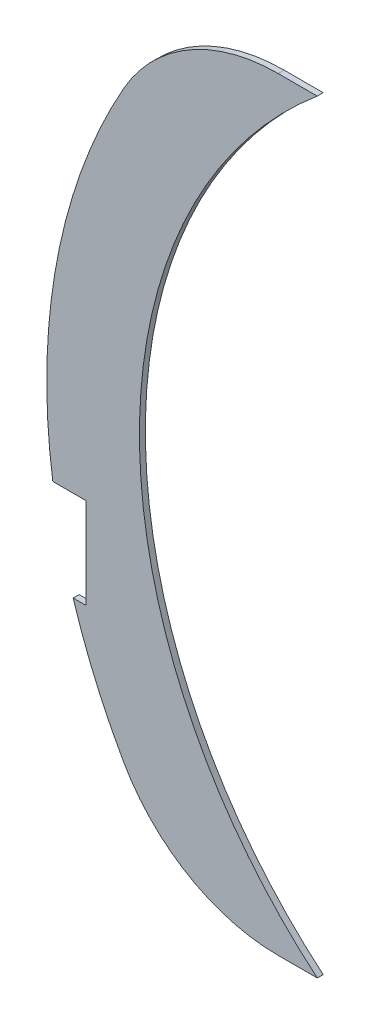
from build123d import *

# Parameters (mm, degrees)
FLANGE_BASE1_START    = -3
FLANGE_BASE1_DEPTH    = 3
ESBO_O2_W             = 58.045623223
ESBO_O2_H             = 46
CORTE_EXTRUS_O1_DEPTH = 10
CORTE_EXTRUS_O2_START = -10
CORTE_EXTRUS_O2_DEPTH = 10


# Read off the part's stored shape, not the designer's step: Flange-base1
with BuildPart() as part:
    # Flange-base1 outline → Flange-base1 (new body)
    with BuildSketch(Plane.XY.offset(FLANGE_BASE1_START)):
        with BuildLine():
            ThreePointArc((-158.113883008, 56.35083269), (-250, 250), (-158.113883008, 443.64916731))
            Line((-158.113883008, 443.64916731), (-182.638577841, 443.64916731))
            ThreePointArc((-182.638577841, 443.64916731), (-227.927116936, 431.424151892), (-260.912254059, 398.070239015))
            ThreePointArc((-260.912254059, 398.070239015), (-300, 250), (-260.912254059, 101.929760985))
            ThreePointArc((-260.912254059, 101.929760985), (-227.927116936, 68.575848108), (-182.638577841, 56.35083269))
            Line((-182.638577841, 56.35083269), (-158.113883008, 56.35083269))
        make_face()
    extrude(amount=FLANGE_BASE1_DEPTH)

    # Esboço2 → Corte-extrusão1 (cut)
    with BuildSketch(Plane.XY):
        with Locations((-309.022811612, 184.35083269)):
            Rectangle(ESBO_O2_W, ESBO_O2_H)
    extrude(amount=-CORTE_EXTRUS_O1_DEPTH, mode=Mode.SUBTRACT)

    # Esboço3 → Corte-extrusão2 (cut)
    with BuildSketch(Plane.XY.offset(CORTE_EXTRUS_O2_START)):
        with BuildLine():
            Line((-160.011249605, 445.972957318), (-158.113883008, 443.64916731))
            ThreePointArc((-158.113883008, 443.64916731), (-250, 250), (-158.113883008, 56.35083269))
            Line((-158.113883008, 56.35083269), (-160.011249605, 54.027042682))
            ThreePointArc((-160.011249605, 54.027042682), (-253, 250), (-160.011249605, 445.972957318))
        make_face()
    extrude(amount=CORTE_EXTRUS_O2_DEPTH, mode=Mode.SUBTRACT)


solid = part.part
